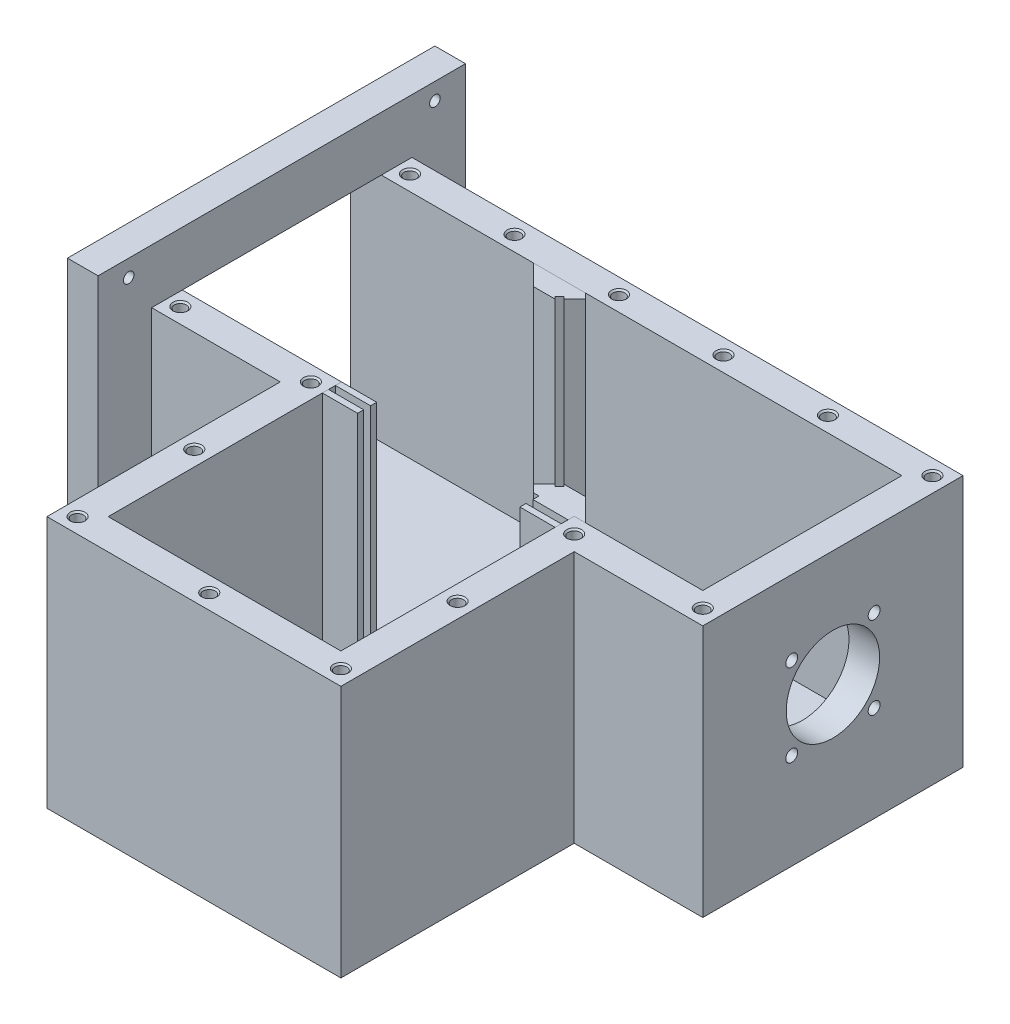
from build123d import *

# Parameters (mm, degrees)
FLOOR_2_DEPTH                    = 7
WALLS_START                      = 52
WALLS_OUTLINE_W                  = 75.5
WALLS_OUTLINE_H                  = 10
WALLS_DEPTH                      = 96
WALLS_START_2                    = 10
WALLS_2_OUTLINE_W                = 75.5
WALLS_2_OUTLINE_H                = 10
WALLS_2_DEPTH                    = 52
WALLS_START_3                    = 138
WALLS_3_OUTLINE_W                = 75.5
WALLS_3_OUTLINE_H                = 10
WALLS_3_DEPTH                    = 52
WALLS_4_OUTLINE_W                = 75.5
WALLS_4_OUTLINE_H                = 66.2
WALLS_4_DEPTH                    = 10
WALLS_5_OUTLINE_W                = 75.5
WALLS_5_OUTLINE_H                = 66.2
WALLS_5_DEPTH                    = 10
WALLS_START_4                    = 180
WALLS_6_OUTLINE_W                = 75.5
WALLS_6_OUTLINE_H                = 65
WALLS_6_DEPTH                    = 10
OUTLINE_SKETCH_12_W              = 11.483495706
OUTLINE_SKETCH_12_H              = 2
VERTICAL_SUPPORTS_DEPTH          = 82.5
BEAM_START                       = 7
BEAM_SPLITTER_SUPPORTS_DEPTH     = 2
SM1_FLANGE_SKETCH_R              = 15.25
SM1_FLANGE_SKETCH_R_2            = 1.945
SM1_FLANGE_CUTOUT_DEPTH          = 10
CRYOSTAT_FLANGE_SKETCH_R         = 1.725
CRYOSTAT_FLANGE_SKETCH_W         = 65
CRYOSTAT_FLANGE_SKETCH_H         = 75.5
CRYSTAT_FLANGE_EXTRUSION_DEPTH   = 10
THREADED_INSERT_SKETCH_R         = 1.9431
CUT_EXTRUDE2_DEPTH               = 10
CHAMFER1_SIZE                    = 0.5
F_1_4_20_TAPPED_HOLE1_AT_2_COUNT = 2
F_1_4_20_TAPPED_HOLE1_AT_2_PITCH = 91.581002397
F_1_4_20_TAPPED_HOLE1_AT_3_COUNT = 2
F_1_4_20_TAPPED_HOLE1_AT_3_PITCH = 107.763073453


# Read off the part's stored shape, not the designer's step: Walls, Beam Splitter Supports
with BuildPart() as part:
    # Outline Sketch → Floor 2 (new body)
    with BuildSketch(Plane(origin=(0, 0, 0), x_dir=(1, 0, 0), z_dir=(0, 1, 0))):
        Polygon((10, -75), (52, -75), (52, -151.2), (148, -151.2), (148, -75), (190, -75), (190, 10), (10, 10), (10, 0), (0, 0), (0, -65), (10, -65), align=None)
    extrude(amount=FLOOR_2_DEPTH)

    # Walls outline → Walls (add)
    with BuildSketch(Plane.YZ.offset(WALLS_START)):
        with Locations((44.75, 146.2)):
            Rectangle(WALLS_OUTLINE_W, WALLS_OUTLINE_H)
        with Locations((44.75, -5)):
            Rectangle(WALLS_OUTLINE_W, WALLS_OUTLINE_H)
    extrude(amount=WALLS_DEPTH)

    # Walls 2 outline → Walls 2 (add)
    with BuildSketch(Plane.YZ.offset(WALLS_START_2)):
        with Locations((44.75, 70)):
            Rectangle(WALLS_2_OUTLINE_W, WALLS_2_OUTLINE_H)
        with Locations((44.75, -5)):
            Rectangle(WALLS_2_OUTLINE_W, WALLS_2_OUTLINE_H)
    extrude(amount=WALLS_2_DEPTH)

    # Walls 3 outline → Walls 3 (add)
    with BuildSketch(Plane.YZ.offset(WALLS_START_3)):
        with Locations((44.75, 70)):
            Rectangle(WALLS_3_OUTLINE_W, WALLS_3_OUTLINE_H)
        with Locations((44.75, -5)):
            Rectangle(WALLS_3_OUTLINE_W, WALLS_3_OUTLINE_H)
    extrude(amount=WALLS_3_DEPTH)

    # Walls 4 outline → Walls 4 (add)
    with BuildSketch(Plane.YZ.offset(WALLS_START)):
        with Locations((44.75, 108.1)):
            Rectangle(WALLS_4_OUTLINE_W, WALLS_4_OUTLINE_H)
    extrude(amount=WALLS_4_DEPTH)

    # Walls 5 outline → Walls 5 (add)
    with BuildSketch(Plane.YZ.offset(WALLS_START_3)):
        with Locations((44.75, 108.1)):
            Rectangle(WALLS_5_OUTLINE_W, WALLS_5_OUTLINE_H)
    extrude(amount=WALLS_5_DEPTH)

    # Walls 6 outline → Walls 6 (add)
    with BuildSketch(Plane.YZ.offset(WALLS_START_4)):
        with Locations((44.75, 32.5)):
            Rectangle(WALLS_6_OUTLINE_W, WALLS_6_OUTLINE_H)
    extrude(amount=WALLS_6_DEPTH)

    # SM1 Flange Sketch → SM1 Flange Cutout (cut)
    with BuildSketch(Plane(origin=(190, 0, 0), x_dir=(0, 0, -1), z_dir=(1, 0, 0))):
        with Locations((-32.5, 44.75)):
            Circle(SM1_FLANGE_SKETCH_R)
        with Locations((-45.962, 58.212)):
            Circle(SM1_FLANGE_SKETCH_R_2)
        with Locations((-19.038, 58.212)):
            Circle(SM1_FLANGE_SKETCH_R_2)
        with Locations((-19.038, 31.288)):
            Circle(SM1_FLANGE_SKETCH_R_2)
        with Locations((-45.962, 31.288)):
            Circle(SM1_FLANGE_SKETCH_R_2)
    extrude(amount=-SM1_FLANGE_CUTOUT_DEPTH, mode=Mode.SUBTRACT)

    # Cryostat Flange Sketch → Crystat Flange Extrusion (add)
    with BuildSketch(Plane.ZY.offset(-10)):
        Polygon((-18.300000062, 100.26689112), (-27.5, 100.26689112), (-27.5, -15.25), (92.5, -15.25), (92.5, 100.26689112), (83.3, 100.26689112), (57.9, 100.26689112), (32.5, 100.26689112), (7.100000012, 100.26689112), align=None)
        with Locations((-17.5, -5.25)):
            Circle(CRYOSTAT_FLANGE_SKETCH_R, mode=Mode.SUBTRACT)
        with Locations((82.5, -5.25)):
            Circle(CRYOSTAT_FLANGE_SKETCH_R, mode=Mode.SUBTRACT)
        with Locations((32.5, 44.75)):
            Rectangle(CRYOSTAT_FLANGE_SKETCH_W, CRYOSTAT_FLANGE_SKETCH_H, mode=Mode.SUBTRACT)
        with Locations((-17.5, 94.75)):
            Circle(CRYOSTAT_FLANGE_SKETCH_R, mode=Mode.SUBTRACT)
        with Locations((82.5, 94.75)):
            Circle(CRYOSTAT_FLANGE_SKETCH_R, mode=Mode.SUBTRACT)
    extrude(amount=CRYSTAT_FLANGE_EXTRUSION_DEPTH)

    # Threaded Insert Sketch → Cut-Extrude2 (cut)
    with BuildSketch(Plane(origin=(0, 82.5, 0), x_dir=(1, 0, 0), z_dir=(0, 1, 0))):
        with Locations(Location((14.3688, 5, 0), (0, 0, 270))):
            Circle(THREADED_INSERT_SKETCH_R)
        with Locations(Location((48.49504, 5, 0), (0, 0, 270))):
            Circle(THREADED_INSERT_SKETCH_R)
        with Locations(Location((82.62128, 5, 0), (0, 0, 270))):
            Circle(THREADED_INSERT_SKETCH_R)
        with Locations(Location((116.74752, 5, 0), (0, 0, 270))):
            Circle(THREADED_INSERT_SKETCH_R)
        with Locations(Location((185, 5, 0), (0, 0, 270))):
            Circle(THREADED_INSERT_SKETCH_R)
        with Locations(Location((150.87376, 5, 0), (0, 0, 270))):
            Circle(THREADED_INSERT_SKETCH_R)
        with Locations(Location((185, -70, 0), (0, 0, 270))):
            Circle(THREADED_INSERT_SKETCH_R)
        with Locations(Location((143, -70, 0), (0, 0, 270))):
            Circle(THREADED_INSERT_SKETCH_R)
        with Locations(Location((143, -108.1, 0), (0, 0, 270))):
            Circle(THREADED_INSERT_SKETCH_R)
        with Locations(Location((100, -146.2, 0), (0, 0, 270))):
            Circle(THREADED_INSERT_SKETCH_R)
        with Locations(Location((143, -146.2, 0), (0, 0, 270))):
            Circle(THREADED_INSERT_SKETCH_R)
        with Locations(Location((57, -146.2, 0), (0, 0, 270))):
            Circle(THREADED_INSERT_SKETCH_R)
        with Locations(Location((57, -108.1, 0), (0, 0, 270))):
            Circle(THREADED_INSERT_SKETCH_R)
        with Locations(Location((57, -70, 0), (0, 0, 270))):
            Circle(THREADED_INSERT_SKETCH_R)
        with Locations(Location((14.3688, -70, 0), (0, 0, 270))):
            Circle(THREADED_INSERT_SKETCH_R)
    extrude(amount=-CUT_EXTRUDE2_DEPTH, mode=Mode.SUBTRACT)

    # Chamfer1
    chamfer1_edges = [part.edges().sort_by_distance(p)[0] for p in [
        (143, 82.5, 106.1569),
        (143, 82.5, 68.0569),
        (185, 82.5, 68.0569),
        (150.87376, 82.5, -6.9431),
        (185, 82.5, -6.9431),
        (116.74752, 82.5, -6.9431),
        (82.62128, 82.5, -6.9431),
        (48.49504, 82.5, -6.9431),
        (100, 82.5, 144.2569),
        (143, 82.5, 144.2569),
        (57, 82.5, 144.2569),
        (57, 82.5, 106.1569),
        (57, 82.5, 68.0569),
        (14.3688, 82.5, 68.0569),
        (14.3688, 82.5, -6.9431),
    ]]
    chamfer(chamfer1_edges, length=CHAMFER1_SIZE)

    # Sketch10 → 1/4-20 Tapped Hole1 (revolve, cut)
    with BuildSketch(Plane(origin=(109.2, 0, 101.2), x_dir=(0, 0, -1), z_dir=(1, 0, 0))):
        Polygon((0, 0), (0, 4.708816902), (2.5527, 3.175), (2.5527, 0), align=None)
    f_1_4_20_tapped_hole1 = revolve(axis=Axis((109.2, -6.35, 101.2), (0, 1, 0)), mode=Mode.SUBTRACT)

    # 1/4-20 Tapped Hole1 at 2: 1/4-20 Tapped Hole1 ×2
    with Locations(*[Vector(0.5547001962252291, 0, -0.8320502943378437) * (i * F_1_4_20_TAPPED_HOLE1_AT_2_PITCH) for i in range(1, F_1_4_20_TAPPED_HOLE1_AT_2_COUNT)]):
        add(f_1_4_20_tapped_hole1, mode=Mode.SUBTRACT)

    # 1/4-20 Tapped Hole1 at 3: 1/4-20 Tapped Hole1 ×2
    with Locations(*[Vector(-0.7071067811865475, 0, -0.7071067811865476) * (i * F_1_4_20_TAPPED_HOLE1_AT_3_PITCH) for i in range(1, F_1_4_20_TAPPED_HOLE1_AT_3_COUNT)]):
        add(f_1_4_20_tapped_hole1, mode=Mode.SUBTRACT)


with BuildPart() as body_2:
    # Outline Sketch<12> → Vertical Supports (new body)
    with BuildSketch(Plane(origin=(0, 0, 0), x_dir=(1, 0, 0), z_dir=(0, 1, 0))):
        Polygon((63.257359313, -3.535533906), (66.792893219, 0), (59.721825407, 0), align=None)
        Polygon((73.483495706, -6.690602487), (72.776388924, -5.983495706), (66.792893219, 0), (63.257359313, -3.535533906), (66.412427894, -6.690602487), align=None)
        Polygon((69.621320344, 0), (73.156854249, -3.535533906), (76.692388155, 0), align=None)
        Polygon((74.190602487, -4.569282143), (73.156854249, -3.535533906), (69.621320344, 0), (66.792893219, 0), (72.776388924, -5.983495706), align=None)
        Polygon((76.692388155, 0), (73.156854249, -3.535533906), (74.190602487, -4.569282143), (77.726136393, -1.033748237), align=None)
        Polygon((77.726136393, -1.033748237), (74.190602487, -4.569282143), (74.897709268, -5.276388924), (78.433243174, -1.740855018), align=None)
        Polygon((126.516504294, -59.723611076), (125.809397513, -59.016504294), (122.273863607, -62.5520382), (124.721825407, -65), (128.257359313, -61.464466094), align=None)
        Polygon((134.621320344, -65), (127.930717857, -58.309397513), (126.516504294, -59.723611076), (128.257359313, -61.464466094), (131.792893219, -65), align=None)
        Polygon((134.294678888, -57.602290732), (127.223611076, -57.602290732), (127.930717857, -58.309397513), (134.621320344, -65), (138.156854249, -61.464466094), align=None)
        Polygon((138, -65), (141.692388155, -65), (138.156854249, -61.464466094), (134.621320344, -65), align=None)
        Polygon((126.516504294, -65), (131.792893219, -65), (128.257359313, -61.464466094), (124.721825407, -65), align=None)
        Polygon((138, -67), (138, -65), (134.621320344, -65), (131.792893219, -65), (126.516504294, -65), (126.516504294, -67), align=None)
        with Locations((132.258252147, -70.25)):
            Rectangle(OUTLINE_SKETCH_12_W, OUTLINE_SKETCH_12_H)
        with Locations((67.741747853, -66)):
            Rectangle(OUTLINE_SKETCH_12_W, OUTLINE_SKETCH_12_H)
        with Locations((67.741747853, -70.25)):
            Rectangle(OUTLINE_SKETCH_12_W, OUTLINE_SKETCH_12_H)
    extrude(amount=VERTICAL_SUPPORTS_DEPTH)


with BuildPart() as body_3:
    # Beam Splitter Supports outline → Beam Splitter Supports (new body)
    with BuildSketch(Plane(origin=(0, 0, 0), x_dir=(1, 0, 0), z_dir=(0, 1, 0)).offset(BEAM_START)):
        Polygon((59.721825407, 0), (124.721825407, -65), (141.692388155, -65), (76.692388155, 0), align=None)
        Polygon((74.190602487, -4.569282143), (127.930717857, -58.309397513), (126.516504294, -59.723611076), (72.776388924, -5.983495706), align=None, mode=Mode.SUBTRACT)
    extrude(amount=BEAM_SPLITTER_SUPPORTS_DEPTH)


solid = Compound([part.part, body_2.part, body_3.part])
